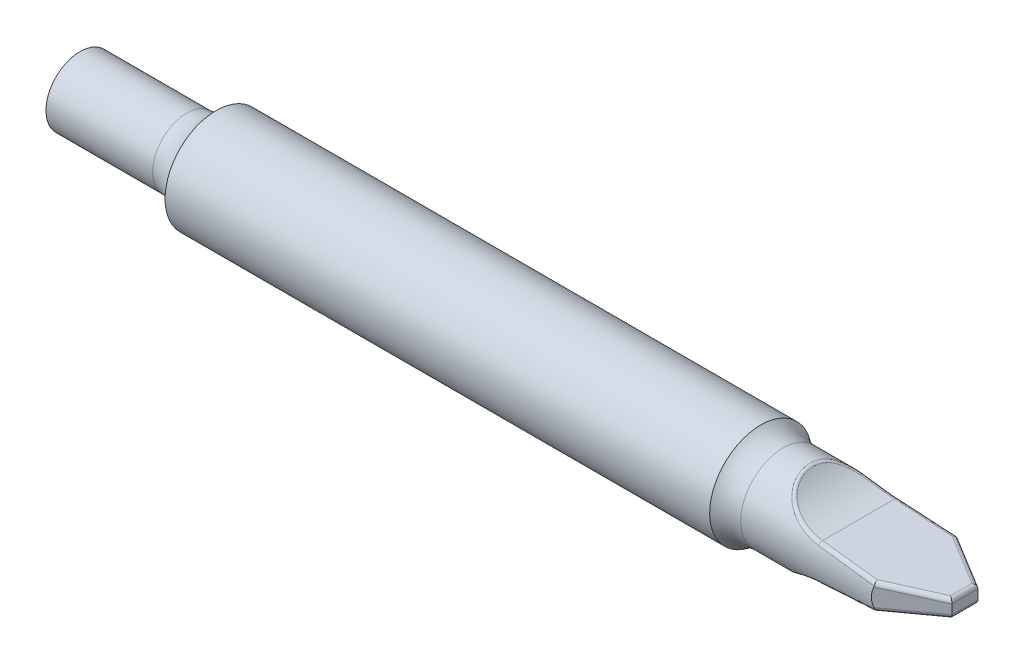
from build123d import *

# Parameters (mm, degrees)
SKETCH1_R           = 12.7
BASE_EXTRUDE_DEPTH  = 50.8
SKETCH2_R           = 19.05
BOSS_EXTRUDE1_DEPTH = 203.2
SKETCH3_R           = 15.875
BOSS_EXTRUDE2_DEPTH = 76.2
FILLET1_R           = 12.7
FILLET2_R           = 12.7
CUT_EXTRUDE1_DEPTH  = 38.1
CUT_EXTRUDE2_DEPTH  = 38.1
FILLET3_R           = 1.524


with BuildPart() as part:
    # Sketch1 → Base-Extrude (new body)
    with BuildSketch(Plane(origin=(0, 0, 0), x_dir=(0, 0, -1), z_dir=(1, 0, 0))):
        Circle(SKETCH1_R)
    extrude(amount=BASE_EXTRUDE_DEPTH)

    # Sketch2 → Boss-Extrude1 (add)
    with BuildSketch(Plane(origin=(50.8, 0, 0), x_dir=(0, 0, -1), z_dir=(1, 0, 0))):
        Circle(SKETCH2_R)
    extrude(amount=BOSS_EXTRUDE1_DEPTH)

    # Sketch3 → Boss-Extrude2 (add)
    with BuildSketch(Plane(origin=(254, 0, 0), x_dir=(0, 0, -1), z_dir=(1, 0, 0))):
        with Locations(Location((0, 0, 0), (0, 0, 180))):
            Circle(SKETCH3_R)
    extrude(amount=BOSS_EXTRUDE2_DEPTH)

    # Fillet1
    # the kernel refuses this fillet: 12.7 mm, written as the material it adds along each edge
    with BuildSketch(Plane(origin=(254, 0, 0), x_dir=(0, 0, 1), z_dir=(0, 1, 0))) as fillet1_piece_1:
        with BuildLine():
            CenterArc((28.575, 8.400260413), FILLET1_R, 180, 41.409622109)
            Line((15.875, 8.400260413), (15.621, 8.400260413))
            Line((15.621, 8.400260413), (15.621, 0))
            Line((15.621, 0), (15.875, -0.254))
            ThreePointArc((15.875, -0.254), (17.4625, -0.254), (18.8595, -0.168005208))
            Line((18.8595, -0.168005208), (19.05, 0))
        make_face()
    revolve(axis=Axis((254, 0, 0), (1, 0, 0)))

    # Fillet2
    # the kernel refuses this fillet: 12.7 mm, written as the material it adds along each edge
    with BuildSketch(Plane(origin=(50.8, 0, 0), x_dir=(0, 0, -1), z_dir=(0, -1, 0))) as fillet2_piece_1:
        with BuildLine():
            CenterArc((25.4, -10.998522628), FILLET2_R, 120, 60)
            Line((12.7, -10.998522628), (12.446, -10.998522628))
            Line((12.446, -10.998522628), (12.446, 0))
            Line((12.446, 0), (12.7, 0.254))
            ThreePointArc((12.7, 0.254), (15.875, 0.254), (18.923, 0.219970453))
            Line((18.923, 0.219970453), (19.05, 0))
        make_face()
    revolve(axis=Axis((50.8, 0, 0), (1, 0, 0)))

    # Sketch4 → Cut-Extrude1 (cut, symmetric)
    with BuildSketch(Plane.XY):
        with BuildLine():
            Line((290.501045638, 6.648208461), (330.2, 3.175))
            Line((330.2, 3.175), (330.2, 15.875))
            Line((330.2, 15.875), (273.05, 15.875))
            ThreePointArc((273.05, 15.875), (280.842512816, 9.496960468), (290.501045638, 6.648208461))
        make_face()
    cut_extrude1 = extrude(amount=CUT_EXTRUDE1_DEPTH, both=True, mode=Mode.SUBTRACT)

    # Mirror1: Cut-Extrude1 across plane
    add(cut_extrude1.mirror(Plane.ZX), mode=Mode.SUBTRACT)

    # Sketch5 → Cut-Extrude2 (cut, symmetric)
    with BuildSketch(Plane(origin=(0, 0, 0), x_dir=(1, 0, 0), z_dir=(0, 1, 0))):
        Polygon((311.15, 15.875), (330.2, 4.876477372), (330.2, 15.875), align=None)
    cut_extrude2 = extrude(amount=CUT_EXTRUDE2_DEPTH, both=True, mode=Mode.SUBTRACT)

    # Mirror2: Cut-Extrude2 across plane
    add(cut_extrude2.mirror(Plane.XY), mode=Mode.SUBTRACT)

    # Fillet3
    fillet3_edges = [part.edges().sort_by_distance(p)[0] for p in [
        (278.08907697, 11.185037911, -11.265458355),
        (301.449385035, 5.690352879, -14.820104896),
        (278.089077171, -11.185037783, -11.265458317),
        (301.449385035, -5.690352879, -14.820104896),
        (321.300051591, -3.953644592, -10.014864981),
        (321.300051591, 3.953644592, -10.014864981),
        (330.2, -3.175, 0),
        (321.300051591, -3.953644592, 10.014864981),
        (330.2, 3.175, 0),
        (321.300051591, 3.953644592, 10.014864981),
    ]]
    fillet(fillet3_edges, radius=FILLET3_R)


solid = part.part
